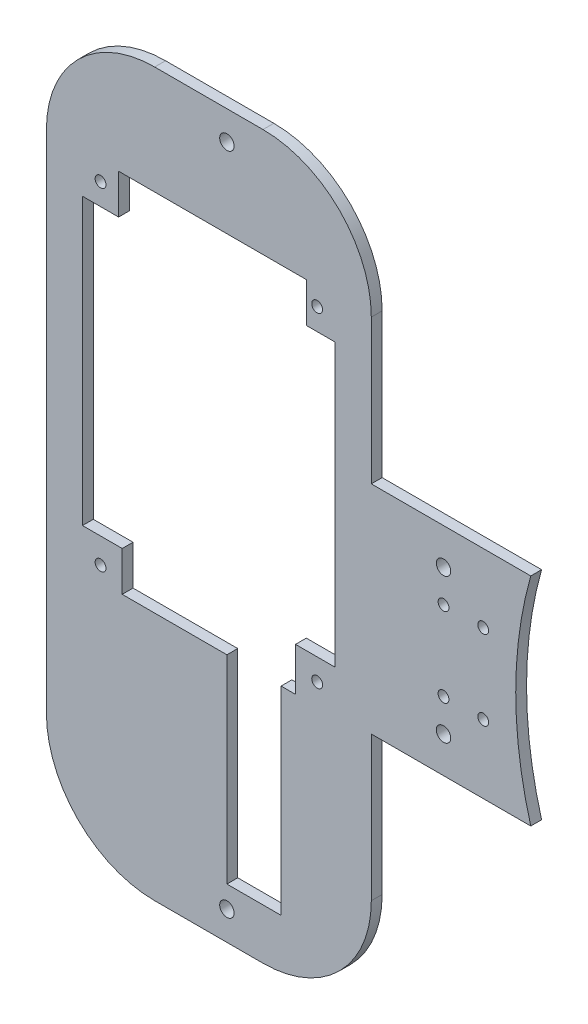
from build123d import *

# Parameters (mm, degrees)
CROQUIS1_R              = 100
SALIENTE_EXTRUIR1_DEPTH = 3
CROQUIS3_R              = 110
CORTAR_EXTRUIR1_DEPTH   = 3
REDONDEO1_R             = 10
CROQUIS12_R             = 1.5
CORTAR_EXTRUIR6_DEPTH   = 142.453172607
CROQUIS13_R             = 2
CORTAR_EXTRUIR7_DEPTH   = 142.453172607
CROQUIS19_W             = 75
CROQUIS19_H             = 190
CROQUIS19_W_2           = 55
CROQUIS19_H_2           = 72
CORTAR_EXTRUIR11_DEPTH  = 142.453172607
CROQUIS20_R             = 1.5
CORTAR_EXTRUIR12_DEPTH  = 131.742418793
CROQUIS21_R             = 1.5
CORTAR_EXTRUIR13_DEPTH  = 10
CROQUIS22_W             = 90
CROQUIS22_H             = 20
SALIENTE_EXTRUIR2_DEPTH = 3
CROQUIS23_W             = 15
CROQUIS23_H             = 55
CROQUIS23_R             = 2
CORTAR_EXTRUIR14_DEPTH  = 131.742418793
REDONDEO2_R             = 30


with BuildPart() as part:
    # Croquis1 → Saliente-Extruir1 (new body)
    with BuildSketch(Plane.XY):
        Circle(CROQUIS1_R)
    extrude(amount=SALIENTE_EXTRUIR1_DEPTH)

    # Croquis3 → Cortar-Extruir1 (cut)
    with BuildSketch(Plane.XY.offset(3)):
        with Locations((190, 0)):
            Circle(CROQUIS3_R)
    extrude(amount=-CORTAR_EXTRUIR1_DEPTH, mode=Mode.SUBTRACT)

    # Redondeo1
    redondeo1_edges = [part.edges().sort_by_distance(p)[0] for p in [
        (89.473684211, -44.659375654, 1.5),
        (89.473684211, 44.659375654, 1.5),
    ]]
    fillet(redondeo1_edges, radius=REDONDEO1_R)

    # Croquis12 → Cortar-Extruir6 (cut, through all)
    with BuildSketch(Plane(origin=(0, 0, 0), x_dir=(-1, 0, 0), z_dir=(0, 0, -1))):
        with Locations((-71, 11)):
            Circle(CROQUIS12_R)
        with Locations((-71, -11)):
            Circle(CROQUIS12_R)
        with Locations((-60, 11)):
            Circle(CROQUIS12_R)
        with Locations((-60, -11)):
            Circle(CROQUIS12_R)
    extrude(amount=-CORTAR_EXTRUIR6_DEPTH, mode=Mode.SUBTRACT)

    # Croquis13 → Cortar-Extruir7 (cut, through all)
    with BuildSketch(Plane(origin=(0, 0, 0), x_dir=(-1, 0, 0), z_dir=(0, 0, -1))):
        with Locations((2.63e-07, 92)):
            Circle(CROQUIS13_R)
        with Locations((-5.2e-08, -92)):
            Circle(CROQUIS13_R)
        with Locations((70.711068531, 30)):
            Circle(CROQUIS13_R)
        with Locations((70.711643931, -30)):
            Circle(CROQUIS13_R)
        with Locations((-60, 20)):
            Circle(CROQUIS13_R)
        with Locations((-60, -20)):
            Circle(CROQUIS13_R)
    extrude(amount=-CORTAR_EXTRUIR7_DEPTH, mode=Mode.SUBTRACT)

    # Croquis19 → Cortar-Extruir11 (cut, through all)
    with BuildSketch(Plane(origin=(0, 0, 0), x_dir=(-1, 0, 0), z_dir=(0, 0, -1))):
        with Locations((87.5, 0)):
            Rectangle(CROQUIS19_W, CROQUIS19_H)
        with Locations((-67.5, -66)):
            Rectangle(CROQUIS19_W_2, CROQUIS19_H_2)
        with Locations((-67.5, 66)):
            Rectangle(CROQUIS19_W_2, CROQUIS19_H_2)
    extrude(amount=-CORTAR_EXTRUIR11_DEPTH, mode=Mode.SUBTRACT)

    # Croquis20 → Cortar-Extruir12 (cut, through all)
    with BuildSketch(Plane(origin=(0, 0, 0), x_dir=(-1, 0, 0), z_dir=(0, 0, -1))):
        with Locations((-25, 65)):
            Circle(CROQUIS20_R)
        with Locations((35, -27)):
            Circle(CROQUIS20_R)
    extrude(amount=-CORTAR_EXTRUIR12_DEPTH, mode=Mode.SUBTRACT)

    # Croquis21 → Cortar-Extruir13 (cut)
    with BuildSketch(Plane(origin=(0, 0, 0), x_dir=(-1, 0, 0), z_dir=(0, 0, -1))):
        Polygon((30, 70), (-22, 70), (-22, 59), (-30, 59), (-30, -19), (-19, -19), (-19, -31), (29, -31), (29, -20), (40, -20), (40, 59), (30, 59), align=None)
        with Locations((35, 65)):
            Circle(CROQUIS21_R)
        with Locations((-25, -25)):
            Circle(CROQUIS21_R)
    extrude(amount=-CORTAR_EXTRUIR13_DEPTH, mode=Mode.SUBTRACT)

    # Croquis22 → Saliente-Extruir2 (add)
    with BuildSketch(Plane(origin=(0, 0, 0), x_dir=(-1, 0, 0), z_dir=(0, 0, -1))):
        with Locations((5, 90)):
            Rectangle(CROQUIS22_W, CROQUIS22_H)
        with Locations((5, -90)):
            Rectangle(CROQUIS22_W, CROQUIS22_H)
    extrude(amount=-SALIENTE_EXTRUIR2_DEPTH)

    # Croquis23 → Cortar-Extruir14 (cut, through all)
    with BuildSketch(Plane(origin=(0, 0, 0), x_dir=(-1, 0, 0), z_dir=(0, 0, -1))):
        with Locations((-7.5, -58.5)):
            Rectangle(CROQUIS23_W, CROQUIS23_H)
        with Locations((0, 92)):
            Circle(CROQUIS23_R)
        with Locations((0, -92)):
            Circle(CROQUIS23_R)
    extrude(amount=-CORTAR_EXTRUIR14_DEPTH, mode=Mode.SUBTRACT)

    # Redondeo2
    redondeo2_edges = [part.edges().sort_by_distance(p)[0] for p in [
        (-50, -100, 1.5),
        (40, -100, 1.5),
        (-50, 100, 1.5),
        (40, 100, 1.5),
    ]]
    fillet(redondeo2_edges, radius=REDONDEO2_R)


solid = part.part
